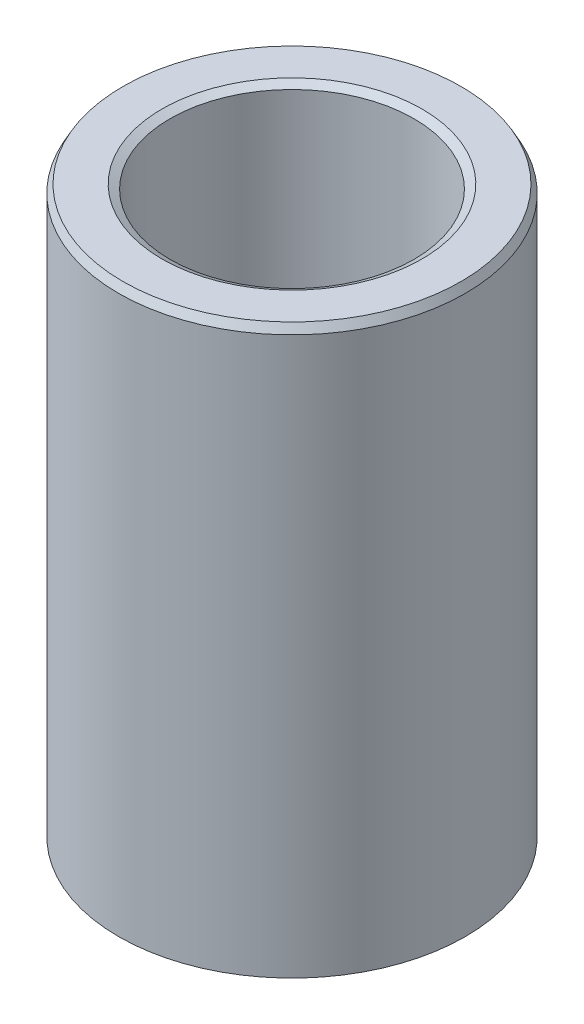
from build123d import *
from OCP.BRepFilletAPI import BRepFilletAPI_MakeChamfer

# Parameters (mm, degrees)
SKETCH1_R           = 40
BOSS_EXTRUDE1_DEPTH = 131.380716441
SKETCH2_R           = 28.133044161
CUT_EXTRUDE1_DEPTH  = 144.041576657
CHAMFER1_SIZE       = 1.857500151
CHAMFER1_SIZE2      = 1.011357009


with BuildPart() as part:
    # Sketch1 → Boss-Extrude1 (new body)
    with BuildSketch(Plane(origin=(0, 0, 0), x_dir=(1, 0, 0), z_dir=(0, 1, 0))):
        Circle(SKETCH1_R)
    extrude(amount=BOSS_EXTRUDE1_DEPTH)

    # Sketch2 → Cut-Extrude1 (cut, through all)
    with BuildSketch(Plane(origin=(0, 0, 0), x_dir=(1, 0, 0), z_dir=(0, 1, 0))):
        Circle(SKETCH2_R)
    extrude(amount=CUT_EXTRUDE1_DEPTH, mode=Mode.SUBTRACT)

    # Chamfer1: one chamfer whose edges measure the first distance from different faces: ONE call of the kernel's chamfer builder (chamfer() names one face for all edges)
    chamfer1_edges_1 = [part.edges().sort_by_distance(p)[0] for p in [
        (-28.133044161, 131.380716441, 0),
    ]]
    chamfer1_side_1 = [part.faces().sort_by_distance(p)[0] for p in [
        (-38.86862915, 131.380716441, 0),
    ]]
    chamfer1_edges_2 = [part.edges().sort_by_distance(p)[0] for p in [
        (-28.133044161, 0, 0),
    ]]
    chamfer1_side_2 = [part.faces().sort_by_distance(p)[0] for p in [
        (-28.133044161, 65.69035822, 0),
    ]]
    chamfer1_edges_3 = [part.edges().sort_by_distance(p)[0] for p in [
        (-40, 0, 0),
    ]]
    chamfer1_side_3 = [part.faces().sort_by_distance(p)[0] for p in [
        (-38.86862915, 0, 0),
    ]]
    chamfer1_edges_4 = [part.edges().sort_by_distance(p)[0] for p in [
        (-40, 131.380716441, 0),
    ]]
    chamfer1_side_4 = [part.faces().sort_by_distance(p)[0] for p in [
        (-40, 65.69035822, 0),
    ]]
    chamfer1 = BRepFilletAPI_MakeChamfer(part.part.solid().wrapped)
    for e in chamfer1_edges_1:
        chamfer1.Add(CHAMFER1_SIZE, CHAMFER1_SIZE2, e.wrapped, chamfer1_side_1[0].wrapped)  # the first distance lies on this face
    for e in chamfer1_edges_2:
        chamfer1.Add(CHAMFER1_SIZE, CHAMFER1_SIZE2, e.wrapped, chamfer1_side_2[0].wrapped)  # the first distance lies on this face
    for e in chamfer1_edges_3:
        chamfer1.Add(CHAMFER1_SIZE, CHAMFER1_SIZE2, e.wrapped, chamfer1_side_3[0].wrapped)  # the first distance lies on this face
    for e in chamfer1_edges_4:
        chamfer1.Add(CHAMFER1_SIZE, CHAMFER1_SIZE2, e.wrapped, chamfer1_side_4[0].wrapped)  # the first distance lies on this face
    add(Compound.cast(chamfer1.Shape()), mode=Mode.REPLACE)


solid = part.part
